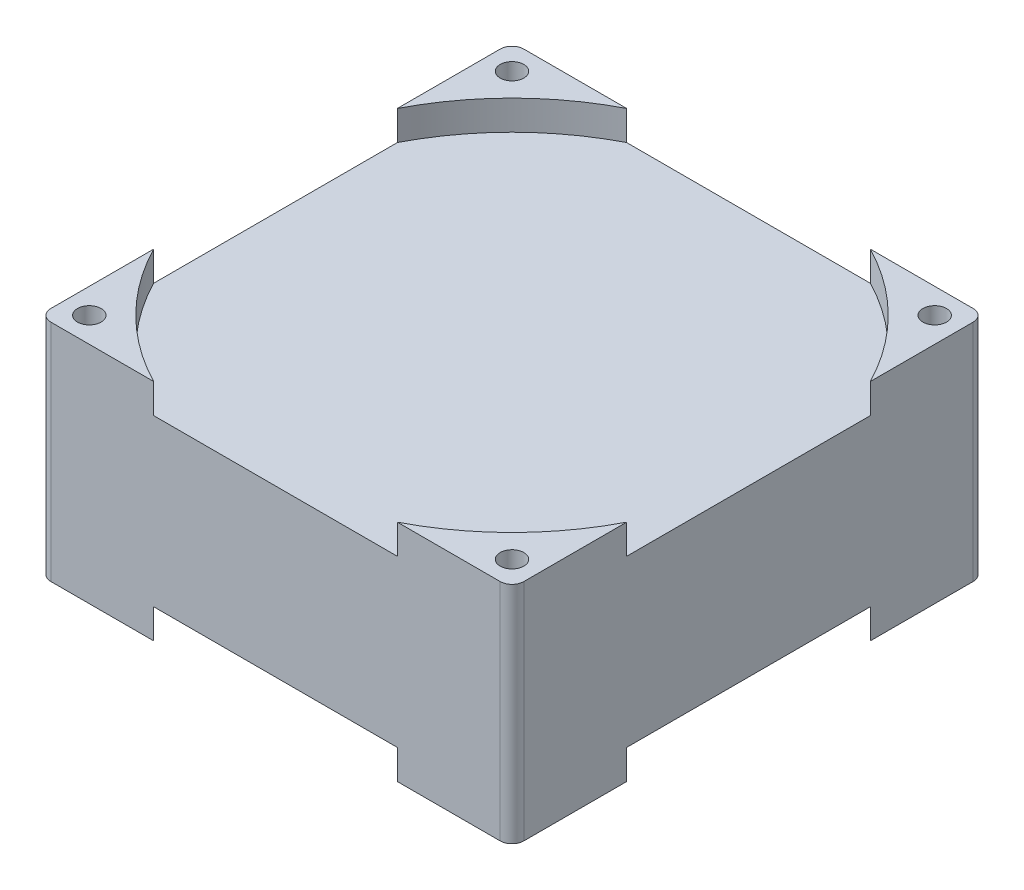
from build123d import *

# Parameters (mm, degrees)
SKETCH1_W          = 80
SKETCH1_H          = 80
BODY_DEPTH         = 38
SKETCH2_R          = 2
CUT_EXTRUDE1_DEPTH = 38
CUT_EXTRUDE2_DEPTH = 5
FILLET1_R          = 2
SKETCH4_W          = 1.709615385
SKETCH4_H          = 6.960576923
CUT_EXTRUDE3_DEPTH = 1


with BuildPart() as part:
    # Sketch1 → Body (new body)
    with BuildSketch(Plane(origin=(0, 0, 0), x_dir=(1, 0, 0), z_dir=(0, 1, 0))):
        Rectangle(SKETCH1_W, SKETCH1_H)
    extrude(amount=BODY_DEPTH)

    # Sketch2 → Cut-Extrude1 (cut)
    with BuildSketch(Plane(origin=(0, 38, 0), x_dir=(1, 0, 0), z_dir=(0, 1, 0))):
        with Locations((-35.75, 35.75)):
            Circle(SKETCH2_R)
        with Locations((35.75, 35.75)):
            Circle(SKETCH2_R)
        with Locations((35.75, -35.75)):
            Circle(SKETCH2_R)
        with Locations((-35.75, -35.75)):
            Circle(SKETCH2_R)
    extrude(amount=-CUT_EXTRUDE1_DEPTH, mode=Mode.SUBTRACT)

    # Sketch3 → Cut-Extrude2 (cut)
    with BuildSketch(Plane(origin=(0, 38, 0), x_dir=(1, 0, 0), z_dir=(0, 1, 0))):
        with BuildLine():
            Line((-40, 20.615528128), (-40, -20.615528128))
            ThreePointArc((-40, -20.615528128), (-31.819805153, -31.819805153), (-20.615528128, -40))
            Line((-20.615528128, -40), (20.615528128, -40))
            ThreePointArc((20.615528128, -40), (31.819805153, -31.819805153), (40, -20.615528128))
            Line((40, -20.615528128), (40, 20.615528128))
            ThreePointArc((40, 20.615528128), (31.819805153, 31.819805153), (20.615528128, 40))
            Line((20.615528128, 40), (-20.615528128, 40))
            ThreePointArc((-20.615528128, 40), (-31.819805153, 31.819805153), (-40, 20.615528128))
        make_face()
    cut_extrude2 = extrude(amount=-CUT_EXTRUDE2_DEPTH, mode=Mode.SUBTRACT)

    # Mirror1: Cut-Extrude2 across plane
    add(cut_extrude2.mirror(Plane.ZX.offset(19)), mode=Mode.SUBTRACT)

    # Fillet1
    fillet1_edges = [part.edges().sort_by_distance(p)[0] for p in [
        (-40, 19, 40),
        (40, 19, 40),
        (40, 19, -40),
        (-40, 19, -40),
    ]]
    fillet(fillet1_edges, radius=FILLET1_R)

    # Sketch4 → Cut-Extrude3 (cut)
    # profile 1 of 12: a face of its own
    with BuildSketch(Plane.ZY.offset(40)):
        Polygon((-34.596634615, 26.038548693), (-29.467788462, 26.038548693), (-29.467788462, 24.328933309), (-31.177403846, 24.328933309), (-31.177403846, 16.513548693), (-32.887019231, 16.513548693), (-32.887019231, 24.328933309), (-34.596634615, 24.328933309), align=None)
    # profile 2 of 12: a face of its own
    with BuildSketch(Plane.ZY.offset(40)):
        with BuildLine():
            Line((-28.36875, 26.282779462), (-26.659134615, 26.282779462))
            Line((-26.659134615, 26.282779462), (-26.659134615, 22.720444727))
            add(Edge.make_bspline(
                [(-26.659134615, 22.720444727), (-26.573017665, 22.790480118), (-26.405160806, 22.926991231), (-26.141787891, 23.104832819), (-25.878959731, 23.256592871), (-25.613887331, 23.379584016), (-25.347720672, 23.475964976), (-25.080000128, 23.544316743), (-24.810467967, 23.589161535), (-24.629777635, 23.593878662), (-24.539287861, 23.596241001)],
                knots=[0, 0, 0, 0, 1.13710654, 2.216417683, 3.252896077, 4.244436563, 5.207303112, 6.149540546, 7.073289332, 8, 8, 8, 8], degree=3))
            add(Edge.make_bspline(
                [(-24.539287861, 23.596241001), (-24.45269522, 23.593943337), (-24.282706595, 23.589432829), (-24.033322976, 23.55685279), (-23.794463271, 23.500790943), (-23.565539061, 23.423724215), (-23.3481253, 23.320080819), (-23.139394764, 23.198675667), (-22.941828495, 23.053220939), (-22.821620674, 22.94109734), (-22.760982572, 22.884537275)],
                knots=[0, 0, 0, 0, 1.056403236, 2.073808271, 3.062028718, 4.046096703, 5.014652014, 5.995532726, 6.988858718, 8, 8, 8, 8], degree=3))
            add(Edge.make_bspline(
                [(-22.760982572, 22.884537275), (-22.711182683, 22.831687074), (-22.610860359, 22.725219869), (-22.485911582, 22.541672866), (-22.37801956, 22.341744633), (-22.290102944, 22.12355646), (-22.224718005, 21.887006782), (-22.174096804, 21.63404433), (-22.146102203, 21.361907041), (-22.142647282, 21.174346641), (-22.140865385, 21.077611193)],
                knots=[0, 0, 0, 0, 0.887296576, 1.787466942, 2.706642908, 3.663267187, 4.658426068, 5.705361056, 6.816525637, 8, 8, 8, 8], degree=3))
            Line((-22.140865385, 21.077611193), (-22.140865385, 16.513548693))
            Line((-22.140865385, 16.513548693), (-23.850480769, 16.513548693))
            Line((-23.850480769, 16.513548693), (-23.850480769, 19.539720568))
            add(Edge.make_bspline(
                [(-23.850480769, 19.539720568), (-23.850812951, 19.635762128), (-23.851448782, 19.819595581), (-23.857158552, 20.083585245), (-23.866482786, 20.323409763), (-23.879234101, 20.53914161), (-23.897037724, 20.729879207), (-23.914548838, 20.896989689), (-23.939121034, 21.039672033), (-23.975914783, 21.194709961), (-24.035793355, 21.360535536), (-24.122806668, 21.537298471), (-24.239032545, 21.683182222), (-24.373535256, 21.803499741), (-24.529051829, 21.895330623), (-24.700014923, 21.963155319), (-24.889347248, 22.00129825), (-25.020583896, 22.006195284), (-25.088807091, 22.008741001)],
                knots=[0, 0, 0, 0, 1.461461505, 2.797388094, 4.017818807, 5.113567707, 6.085313608, 6.932873269, 7.669572396, 8.286941306, 9.355291607, 10.346554054, 11.270113241, 12.175128673, 13.078071705, 14.003657132, 14.962203834, 16, 16, 16, 16], degree=3))
            add(Edge.make_bspline(
                [(-25.088807091, 22.008741001), (-25.177681703, 22.0052666), (-25.351752649, 21.998461593), (-25.601378087, 21.928412188), (-25.831624713, 21.817690212), (-26.039805335, 21.664234535), (-26.221212655, 21.472025189), (-26.373203994, 21.246736639), (-26.497524587, 20.990622261), (-26.551258186, 20.803859227), (-26.578996394, 20.707448934)],
                knots=[0, 0, 0, 0, 0.993549393, 1.945978497, 2.879753144, 3.843180486, 4.826017097, 5.826060929, 6.877775219, 8, 8, 8, 8], degree=3))
            add(Edge.make_bspline(
                [(-26.578996394, 20.707448934), (-26.585903267, 20.677649914), (-26.601653198, 20.6096984), (-26.613714793, 20.493761444), (-26.631614009, 20.353613531), (-26.63782296, 20.188414819), (-26.649453796, 19.998420111), (-26.653636702, 19.783322006), (-26.657847826, 19.542918283), (-26.658691897, 19.37435929), (-26.659134615, 19.285949535)],
                knots=[0, 0, 0, 0, 0.514379255, 1.17295301, 1.959069106, 2.891908278, 3.953016936, 5.163065833, 6.51201855, 8, 8, 8, 8], degree=3))
            Line((-26.659134615, 19.285949535), (-26.659134615, 16.513548693))
            Line((-26.659134615, 16.513548693), (-28.36875, 16.513548693))
            Line((-28.36875, 16.513548693), (-28.36875, 26.282779462))
        make_face()
    # profile 3 of 12: a face of its own
    with BuildSketch(Plane.ZY.offset(40)):
        with BuildLine():
            add(Edge.make_bspline(
                [(-19.702373798, 26.404894847), (-19.628689387, 26.401279611), (-19.484002947, 26.394180747), (-19.276719932, 26.32498261), (-19.086476134, 26.216378203), (-18.91829534, 26.067370368), (-18.778418282, 25.889427759), (-18.671547015, 25.690209177), (-18.612013484, 25.469481405), (-18.603745158, 25.317004968), (-18.599519231, 25.239074535)],
                knots=[0, 0, 0, 0, 0.989868614, 1.943702388, 2.910836514, 3.924849579, 4.949916355, 5.946401046, 6.950409252, 8, 8, 8, 8], degree=3))
            add(Edge.make_bspline(
                [(-18.599519231, 25.239074535), (-18.603593961, 25.161718405), (-18.611533768, 25.010986304), (-18.672917216, 24.793255014), (-18.775499042, 24.594133193), (-18.916509016, 24.418833361), (-19.082866511, 24.272225385), (-19.268953336, 24.161649331), (-19.474249978, 24.096300671), (-19.616691322, 24.088608381), (-19.689017428, 24.084702539)],
                knots=[0, 0, 0, 0, 1.05296456, 2.051751585, 3.055639087, 4.085634717, 5.099016424, 6.062201612, 7.016062274, 8, 8, 8, 8], degree=3))
            add(Edge.make_bspline(
                [(-19.689017428, 24.084702539), (-19.763345043, 24.088304852), (-19.909290249, 24.095378134), (-20.118273411, 24.164738178), (-20.311054576, 24.272487255), (-20.478505802, 24.424539551), (-20.619984765, 24.603746577), (-20.722187853, 24.80760314), (-20.786118412, 25.029840244), (-20.793706914, 25.18457496), (-20.797596154, 25.263879222)],
                knots=[0, 0, 0, 0, 0.989065327, 1.942068821, 2.907541208, 3.917690034, 4.939857478, 5.938239964, 6.943311734, 8, 8, 8, 8], degree=3))
            add(Edge.make_bspline(
                [(-20.797596154, 25.263879222), (-20.793363597, 25.339921798), (-20.785049351, 25.489296461), (-20.725159207, 25.705116808), (-20.620738495, 25.900986214), (-20.481868985, 26.075671417), (-20.315165385, 26.221899696), (-20.125035793, 26.327205716), (-19.9191478, 26.393545772), (-19.775377897, 26.401072761), (-19.702373798, 26.404894847)],
                knots=[0, 0, 0, 0, 1.038616768, 2.040212704, 3.031499824, 4.052181184, 5.074969369, 6.039807101, 7.004644834, 8, 8, 8, 8], degree=3))
        make_face()
    # profile 4 of 12: a face of its own
    with BuildSketch(Plane.ZY.offset(40)):
        with Locations((-19.698557693, 19.993837154)):
            Rectangle(SKETCH4_W, SKETCH4_H)
    # profile 5 of 12: a face of its own
    with BuildSketch(Plane.ZY.offset(40)):
        with BuildLine():
            Line((-12.982211538, 22.399891842), (-14.027824519, 21.276048693))
            add(Edge.make_bspline(
                [(-14.027824519, 21.276048693), (-14.080036985, 21.333824617), (-14.179899652, 21.444328073), (-14.332779745, 21.594968981), (-14.483383155, 21.720408358), (-14.6289034, 21.825782662), (-14.772312521, 21.906592157), (-14.912418468, 21.964732779), (-15.049288463, 22.00164131), (-15.140011682, 22.00641898), (-15.184104567, 22.008741001)],
                knots=[0, 0, 0, 0, 1.327646587, 2.539285, 3.655602211, 4.666613517, 5.598770349, 6.454635452, 7.248928967, 8, 8, 8, 8], degree=3))
            add(Edge.make_bspline(
                [(-15.184104567, 22.008741001), (-15.228722138, 22.00738121), (-15.314150907, 22.004777634), (-15.434710042, 21.98244548), (-15.540629308, 21.943784406), (-15.630255766, 21.891085759), (-15.702263249, 21.826166438), (-15.752679046, 21.751900267), (-15.786533717, 21.670597097), (-15.789397603, 21.612844315), (-15.790865385, 21.583245208)],
                knots=[0, 0, 0, 0, 1.295068245, 2.479652818, 3.543291146, 4.55379989, 5.481948265, 6.332409746, 7.145336708, 8, 8, 8, 8], degree=3))
            add(Edge.make_bspline(
                [(-15.790865385, 21.583245208), (-15.785892406, 21.538389767), (-15.775574053, 21.445319938), (-15.70470128, 21.337372822), (-15.610931483, 21.257742445), (-15.50284202, 21.183641806), (-15.356460905, 21.100789358), (-15.245412476, 21.044057866), (-15.184104567, 21.012737395)],
                knots=[0, 0, 0, 0, 0.916701701, 1.902049539, 2.5493345, 3.440293453, 4.586830489, 6, 6, 6, 6], degree=3))
            Line((-15.184104567, 21.012737395), (-14.565895433, 20.699816722))
            add(Edge.make_bspline(
                [(-14.565895433, 20.699816722), (-14.48724741, 20.659881811), (-14.334655474, 20.582400582), (-14.120125505, 20.457374215), (-13.921982206, 20.336189681), (-13.744200274, 20.211991903), (-13.585691567, 20.086938611), (-13.447581967, 19.959793192), (-13.326521619, 19.834586398), (-13.191522337, 19.666718317), (-13.056482539, 19.443131691), (-12.943901288, 19.152367704), (-12.872109593, 18.841023405), (-12.864166669, 18.625530143), (-12.860096154, 18.515096169)],
                knots=[0, 0, 0, 0, 1.076693506, 2.088987655, 3.030641824, 3.911722491, 4.735175175, 5.493635918, 6.202154166, 6.859459289, 8.120623445, 9.372284821, 10.653373066, 12, 12, 12, 12], degree=3))
            add(Edge.make_bspline(
                [(-12.860096154, 18.515096169), (-12.862548666, 18.440592714), (-12.867348882, 18.294769682), (-12.897694836, 18.08013208), (-12.952204029, 17.8760435), (-13.023938045, 17.679322607), (-13.120561614, 17.493526717), (-13.237867362, 17.317755153), (-13.374002986, 17.149700133), (-13.532567428, 16.995110488), (-13.706272123, 16.85103463), (-13.899374205, 16.729856488), (-14.10333554, 16.62331305), (-14.323544463, 16.540112111), (-14.55691117, 16.472658255), (-14.805436094, 16.425914423), (-15.06827594, 16.396497332), (-15.248260724, 16.393149979), (-15.340564904, 16.391433309)],
                knots=[0, 0, 0, 0, 0.976600749, 1.911466839, 2.833459288, 3.740827163, 4.650527853, 5.570709661, 6.506801416, 7.479409329, 8.468875524, 9.458587492, 10.461481786, 11.480119772, 12.538142914, 13.641687514, 14.790552763, 16, 16, 16, 16], degree=3))
            add(Edge.make_bspline(
                [(-15.340564904, 16.391433309), (-15.462860015, 16.395327728), (-15.70291455, 16.402972132), (-16.053496819, 16.456221952), (-16.384539554, 16.548398289), (-16.696315112, 16.677525546), (-16.990733073, 16.84206907), (-17.26358882, 17.046231563), (-17.519612555, 17.284693733), (-17.668569824, 17.467583111), (-17.744711538, 17.561069727)],
                knots=[0, 0, 0, 0, 1.056901255, 2.07460411, 3.05625841, 4.019970729, 4.984811261, 5.963335951, 6.958928997, 8, 8, 8, 8], degree=3))
            Line((-17.744711538, 17.561069727), (-16.708638822, 18.711625616))
            add(Edge.make_bspline(
                [(-16.708638822, 18.711625616), (-16.658157861, 18.658381183), (-16.557936642, 18.55267357), (-16.389004167, 18.413283791), (-16.210261643, 18.286240261), (-16.019719241, 18.179565148), (-15.829138336, 18.093429795), (-15.646291683, 18.02881623), (-15.474625228, 17.988210967), (-15.363012124, 17.981919495), (-15.310036058, 17.978933309)],
                knots=[0, 0, 0, 0, 1.087861918, 2.159761696, 3.243809206, 4.338405912, 5.394481878, 6.343674753, 7.213841449, 8, 8, 8, 8], degree=3))
            add(Edge.make_bspline(
                [(-15.310036058, 17.978933309), (-15.257088667, 17.980466701), (-15.155309169, 17.983414303), (-15.010654147, 18.014075153), (-14.882439736, 18.065620571), (-14.773709142, 18.137089602), (-14.683269943, 18.219125134), (-14.619545652, 18.312358998), (-14.577407776, 18.41122238), (-14.572286411, 18.480343893), (-14.569711538, 18.515096169)],
                knots=[0, 0, 0, 0, 1.255011871, 2.412479185, 3.488767498, 4.514443302, 5.48617286, 6.365347346, 7.178144445, 8, 8, 8, 8], degree=3))
            add(Edge.make_bspline(
                [(-14.569711538, 18.515096169), (-14.572009089, 18.547822753), (-14.576726402, 18.615016739), (-14.614073521, 18.71419987), (-14.672709234, 18.812407083), (-14.754033768, 18.909915271), (-14.85912925, 19.005933269), (-14.98761957, 19.099692005), (-15.136540452, 19.196193623), (-15.246541892, 19.253792166), (-15.304311899, 19.284041482)],
                knots=[0, 0, 0, 0, 0.704666567, 1.446816302, 2.258757648, 3.165368109, 4.175243826, 5.322435858, 6.59381024, 8, 8, 8, 8], degree=3))
            Line((-15.304311899, 19.284041482), (-15.871003606, 19.570249414))
            add(Edge.make_bspline(
                [(-15.871003606, 19.570249414), (-15.999551907, 19.639182156), (-16.246316448, 19.771507175), (-16.579849862, 19.998416461), (-16.862137747, 20.239965913), (-17.093410143, 20.494857842), (-17.277688446, 20.762376963), (-17.406234926, 21.045929315), (-17.487102403, 21.34282676), (-17.49599912, 21.545848454), (-17.500480769, 21.648119006)],
                knots=[0, 0, 0, 0, 1.255999728, 2.41104856, 3.467751088, 4.449286722, 5.368722015, 6.253902015, 7.120417131, 8, 8, 8, 8], degree=3))
            add(Edge.make_bspline(
                [(-17.500480769, 21.648119006), (-17.49892657, 21.714401165), (-17.495875426, 21.844523812), (-17.463394158, 22.035617938), (-17.414321932, 22.219307972), (-17.345075736, 22.395885631), (-17.256372567, 22.565526127), (-17.147695796, 22.727476609), (-17.017719576, 22.88144265), (-16.870604994, 23.026928291), (-16.707376748, 23.159428329), (-16.532698518, 23.276854346), (-16.347086969, 23.376879477), (-16.149018813, 23.456626627), (-15.941011603, 23.520100395), (-15.721692269, 23.563245335), (-15.491996529, 23.590685667), (-15.334921276, 23.594362985), (-15.254702524, 23.596241001)],
                knots=[0, 0, 0, 0, 0.959035663, 1.882742823, 2.798841253, 3.708806893, 4.623422363, 5.566085165, 6.527241613, 7.536786942, 8.55815439, 9.567237405, 10.580975912, 11.605536372, 12.654523293, 13.725718749, 14.838518481, 16, 16, 16, 16], degree=3))
            add(Edge.make_bspline(
                [(-15.254702524, 23.596241001), (-15.143799581, 23.592589619), (-14.923676802, 23.585342269), (-14.599038996, 23.52669667), (-14.285472549, 23.428126954), (-13.983856535, 23.292314369), (-13.698070677, 23.121636548), (-13.434399544, 22.914376029), (-13.191058702, 22.675636505), (-13.052518558, 22.492719464), (-12.982211538, 22.399891842)],
                knots=[0, 0, 0, 0, 0.996590028, 1.978055413, 2.954661574, 3.945146934, 4.945404762, 5.939399542, 6.954276554, 8, 8, 8, 8], degree=3))
        make_face()
    # profile 6 of 12: a face of its own
    with BuildSketch(Plane.ZY.offset(40)):
        with BuildLine():
            add(Edge.make_bspline(
                [(-7.002373798, 26.404894847), (-6.928689387, 26.401279611), (-6.784002947, 26.394180747), (-6.576719932, 26.32498261), (-6.386476134, 26.216378203), (-6.21829534, 26.067370368), (-6.078418282, 25.889427759), (-5.971547015, 25.690209177), (-5.912013484, 25.469481405), (-5.903745158, 25.317004968), (-5.899519231, 25.239074535)],
                knots=[0, 0, 0, 0, 0.989868614, 1.943702388, 2.910836514, 3.924849579, 4.949916355, 5.946401046, 6.950409252, 8, 8, 8, 8], degree=3))
            add(Edge.make_bspline(
                [(-5.899519231, 25.239074535), (-5.903593961, 25.161718405), (-5.911533768, 25.010986304), (-5.972917216, 24.793255014), (-6.075499042, 24.594133193), (-6.216509016, 24.418833361), (-6.382866511, 24.272225385), (-6.568953336, 24.161649331), (-6.774249978, 24.096300671), (-6.916691322, 24.088608381), (-6.989017428, 24.084702539)],
                knots=[0, 0, 0, 0, 1.05296456, 2.051751585, 3.055639087, 4.085634717, 5.099016424, 6.062201612, 7.016062274, 8, 8, 8, 8], degree=3))
            add(Edge.make_bspline(
                [(-6.989017428, 24.084702539), (-7.063345043, 24.088304852), (-7.209290249, 24.095378134), (-7.418273411, 24.164738178), (-7.611054576, 24.272487255), (-7.778505802, 24.424539551), (-7.919984765, 24.603746577), (-8.022187853, 24.80760314), (-8.086118412, 25.029840244), (-8.093706914, 25.18457496), (-8.097596154, 25.263879222)],
                knots=[0, 0, 0, 0, 0.989065327, 1.942068821, 2.907541208, 3.917690034, 4.939857478, 5.938239964, 6.943311734, 8, 8, 8, 8], degree=3))
            add(Edge.make_bspline(
                [(-8.097596154, 25.263879222), (-8.093363597, 25.339921798), (-8.085049351, 25.489296461), (-8.025159207, 25.705116808), (-7.920738495, 25.900986214), (-7.781868985, 26.075671417), (-7.615165385, 26.221899696), (-7.425035793, 26.327205716), (-7.2191478, 26.393545772), (-7.075377897, 26.401072761), (-7.002373798, 26.404894847)],
                knots=[0, 0, 0, 0, 1.038616768, 2.040212704, 3.031499824, 4.052181184, 5.074969369, 6.039807101, 7.004644834, 8, 8, 8, 8], degree=3))
        make_face()
    # profile 7 of 12: a face of its own
    with BuildSketch(Plane.ZY.offset(40)):
        with Locations((-6.998557693, 19.993837154)):
            Rectangle(SKETCH4_W, SKETCH4_H)
    # profile 8 of 12: a face of its own
    with BuildSketch(Plane.ZY.offset(40)):
        with BuildLine():
            Line((-0.282211538, 22.399891842), (-1.327824519, 21.276048693))
            add(Edge.make_bspline(
                [(-1.327824519, 21.276048693), (-1.380036985, 21.333824617), (-1.479899652, 21.444328073), (-1.632779745, 21.594968981), (-1.783383155, 21.720408358), (-1.9289034, 21.825782662), (-2.072312521, 21.906592157), (-2.212418468, 21.964732779), (-2.349288463, 22.00164131), (-2.440011682, 22.00641898), (-2.484104567, 22.008741001)],
                knots=[0, 0, 0, 0, 1.327646587, 2.539285, 3.655602211, 4.666613517, 5.598770349, 6.454635452, 7.248928967, 8, 8, 8, 8], degree=3))
            add(Edge.make_bspline(
                [(-2.484104567, 22.008741001), (-2.528722138, 22.00738121), (-2.614150907, 22.004777634), (-2.734710042, 21.98244548), (-2.840629308, 21.943784406), (-2.930255766, 21.891085759), (-3.002263249, 21.826166438), (-3.052679046, 21.751900267), (-3.086533717, 21.670597097), (-3.089397603, 21.612844315), (-3.090865385, 21.583245208)],
                knots=[0, 0, 0, 0, 1.295068245, 2.479652818, 3.543291146, 4.55379989, 5.481948265, 6.332409746, 7.145336708, 8, 8, 8, 8], degree=3))
            add(Edge.make_bspline(
                [(-3.090865385, 21.583245208), (-3.085892406, 21.538389767), (-3.075574053, 21.445319938), (-3.00470128, 21.337372822), (-2.910931483, 21.257742445), (-2.80284202, 21.183641806), (-2.656460905, 21.100789358), (-2.545412476, 21.044057866), (-2.484104567, 21.012737395)],
                knots=[0, 0, 0, 0, 0.916701701, 1.902049539, 2.5493345, 3.440293453, 4.586830489, 6, 6, 6, 6], degree=3))
            Line((-2.484104567, 21.012737395), (-1.865895433, 20.699816722))
            add(Edge.make_bspline(
                [(-1.865895433, 20.699816722), (-1.78724741, 20.659881811), (-1.634655474, 20.582400582), (-1.420125505, 20.457374215), (-1.221982206, 20.336189681), (-1.044200274, 20.211991903), (-0.885691567, 20.086938611), (-0.747581967, 19.959793192), (-0.626521619, 19.834586398), (-0.491522337, 19.666718317), (-0.356482539, 19.443131691), (-0.243901288, 19.152367704), (-0.172109593, 18.841023405), (-0.164166669, 18.625530143), (-0.160096154, 18.515096169)],
                knots=[0, 0, 0, 0, 1.076693506, 2.088987655, 3.030641824, 3.911722491, 4.735175175, 5.493635918, 6.202154166, 6.859459289, 8.120623445, 9.372284821, 10.653373066, 12, 12, 12, 12], degree=3))
            add(Edge.make_bspline(
                [(-0.160096154, 18.515096169), (-0.162548666, 18.440592714), (-0.167348882, 18.294769682), (-0.197694836, 18.08013208), (-0.252204029, 17.8760435), (-0.323938045, 17.679322607), (-0.420561614, 17.493526717), (-0.537867362, 17.317755153), (-0.674002986, 17.149700133), (-0.832567428, 16.995110488), (-1.006272123, 16.85103463), (-1.199374205, 16.729856488), (-1.40333554, 16.62331305), (-1.623544463, 16.540112111), (-1.85691117, 16.472658255), (-2.105436094, 16.425914423), (-2.36827594, 16.396497332), (-2.548260724, 16.393149979), (-2.640564904, 16.391433309)],
                knots=[0, 0, 0, 0, 0.976600749, 1.911466839, 2.833459288, 3.740827163, 4.650527853, 5.570709661, 6.506801416, 7.479409329, 8.468875524, 9.458587492, 10.461481786, 11.480119772, 12.538142914, 13.641687514, 14.790552763, 16, 16, 16, 16], degree=3))
            add(Edge.make_bspline(
                [(-2.640564904, 16.391433309), (-2.762860015, 16.395327728), (-3.00291455, 16.402972132), (-3.353496819, 16.456221952), (-3.684539554, 16.548398289), (-3.996315112, 16.677525546), (-4.290733073, 16.84206907), (-4.56358882, 17.046231563), (-4.819612555, 17.284693733), (-4.968569824, 17.467583111), (-5.044711538, 17.561069727)],
                knots=[0, 0, 0, 0, 1.056901255, 2.07460411, 3.05625841, 4.019970729, 4.984811261, 5.963335951, 6.958928997, 8, 8, 8, 8], degree=3))
            Line((-5.044711538, 17.561069727), (-4.008638822, 18.711625616))
            add(Edge.make_bspline(
                [(-4.008638822, 18.711625616), (-3.958157861, 18.658381183), (-3.857936642, 18.55267357), (-3.689004167, 18.413283791), (-3.510261643, 18.286240261), (-3.319719241, 18.179565148), (-3.129138336, 18.093429795), (-2.946291683, 18.02881623), (-2.774625228, 17.988210967), (-2.663012124, 17.981919495), (-2.610036058, 17.978933309)],
                knots=[0, 0, 0, 0, 1.087861918, 2.159761696, 3.243809206, 4.338405912, 5.394481878, 6.343674753, 7.213841449, 8, 8, 8, 8], degree=3))
            add(Edge.make_bspline(
                [(-2.610036058, 17.978933309), (-2.557088667, 17.980466701), (-2.455309169, 17.983414303), (-2.310654147, 18.014075153), (-2.182439736, 18.065620571), (-2.073709142, 18.137089602), (-1.983269943, 18.219125134), (-1.919545652, 18.312358998), (-1.877407776, 18.41122238), (-1.872286411, 18.480343893), (-1.869711538, 18.515096169)],
                knots=[0, 0, 0, 0, 1.255011871, 2.412479185, 3.488767498, 4.514443302, 5.48617286, 6.365347346, 7.178144445, 8, 8, 8, 8], degree=3))
            add(Edge.make_bspline(
                [(-1.869711538, 18.515096169), (-1.872009089, 18.547822753), (-1.876726402, 18.615016739), (-1.914073521, 18.71419987), (-1.972709234, 18.812407083), (-2.054033768, 18.909915271), (-2.15912925, 19.005933269), (-2.28761957, 19.099692005), (-2.436540452, 19.196193623), (-2.546541892, 19.253792166), (-2.604311899, 19.284041482)],
                knots=[0, 0, 0, 0, 0.704666567, 1.446816302, 2.258757648, 3.165368109, 4.175243826, 5.322435858, 6.59381024, 8, 8, 8, 8], degree=3))
            Line((-2.604311899, 19.284041482), (-3.171003606, 19.570249414))
            add(Edge.make_bspline(
                [(-3.171003606, 19.570249414), (-3.299551907, 19.639182156), (-3.546316448, 19.771507175), (-3.879849862, 19.998416461), (-4.162137747, 20.239965913), (-4.393410143, 20.494857842), (-4.577688446, 20.762376963), (-4.706234926, 21.045929315), (-4.787102403, 21.34282676), (-4.79599912, 21.545848454), (-4.800480769, 21.648119006)],
                knots=[0, 0, 0, 0, 1.255999728, 2.41104856, 3.467751088, 4.449286722, 5.368722015, 6.253902015, 7.120417131, 8, 8, 8, 8], degree=3))
            add(Edge.make_bspline(
                [(-4.800480769, 21.648119006), (-4.79892657, 21.714401165), (-4.795875426, 21.844523812), (-4.763394158, 22.035617938), (-4.714321932, 22.219307972), (-4.645075736, 22.395885631), (-4.556372567, 22.565526127), (-4.447695796, 22.727476609), (-4.317719576, 22.88144265), (-4.170604994, 23.026928291), (-4.007376748, 23.159428329), (-3.832698518, 23.276854346), (-3.647086969, 23.376879477), (-3.449018813, 23.456626627), (-3.241011603, 23.520100395), (-3.021692269, 23.563245335), (-2.791996529, 23.590685667), (-2.634921276, 23.594362985), (-2.554702524, 23.596241001)],
                knots=[0, 0, 0, 0, 0.959035663, 1.882742823, 2.798841253, 3.708806893, 4.623422363, 5.566085165, 6.527241613, 7.536786942, 8.55815439, 9.567237405, 10.580975912, 11.605536372, 12.654523293, 13.725718749, 14.838518481, 16, 16, 16, 16], degree=3))
            add(Edge.make_bspline(
                [(-2.554702524, 23.596241001), (-2.443799581, 23.592589619), (-2.223676802, 23.585342269), (-1.899038996, 23.52669667), (-1.585472549, 23.428126954), (-1.283856535, 23.292314369), (-0.998070677, 23.121636548), (-0.734399544, 22.914376029), (-0.491058702, 22.675636505), (-0.352518558, 22.492719464), (-0.282211538, 22.399891842)],
                knots=[0, 0, 0, 0, 0.996590028, 1.978055413, 2.954661574, 3.945146934, 4.945404762, 5.939399542, 6.954276554, 8, 8, 8, 8], degree=3))
        make_face()
    # profile 9 of 12: a face of its own
    with BuildSketch(Plane.ZY.offset(40)):
        with BuildLine():
            Line((10.219711538, 23.474125616), (11.929326923, 23.474125616))
            Line((11.929326923, 23.474125616), (11.929326923, 16.513548693))
            Line((11.929326923, 16.513548693), (10.219711538, 16.513548693))
            Line((10.219711538, 16.513548693), (10.219711538, 17.272953741))
            add(Edge.make_bspline(
                [(10.219711538, 17.272953741), (10.135000726, 17.199034065), (9.970593768, 17.05557057), (9.711541601, 16.869423038), (9.451732453, 16.715875382), (9.189917935, 16.593583048), (8.922074068, 16.503282747), (8.646272482, 16.437903219), (8.358541341, 16.399347312), (8.162945676, 16.394098788), (8.063611779, 16.391433309)],
                knots=[0, 0, 0, 0, 1.129196829, 2.191548051, 3.199897424, 4.157751732, 5.089409408, 6.034969131, 7.002052659, 8, 8, 8, 8], degree=3))
            add(Edge.make_bspline(
                [(8.063611779, 16.391433309), (7.952105064, 16.393941861), (7.731761475, 16.398898902), (7.40843172, 16.451079763), (7.096224698, 16.530954201), (6.795393833, 16.643986513), (6.50648646, 16.790454231), (6.227291561, 16.966535807), (5.962595387, 17.178412757), (5.710194434, 17.416917705), (5.479097636, 17.679274845), (5.277070633, 17.961842696), (5.106776884, 18.260613657), (4.967264328, 18.574597164), (4.857519687, 18.90356277), (4.779287461, 19.248553856), (4.733130358, 19.609693635), (4.727417409, 19.855687909), (4.724519231, 19.980480785)],
                knots=[0, 0, 0, 0, 0.980476535, 1.937477201, 2.874147792, 3.812856188, 4.758993464, 5.720109578, 6.712210464, 7.737600662, 8.772720504, 9.783789959, 10.789002326, 11.793715968, 12.802552247, 13.835794126, 14.902098527, 16, 16, 16, 16], degree=3))
            add(Edge.make_bspline(
                [(4.724519231, 19.980480785), (4.72756088, 20.109703972), (4.733527414, 20.363189652), (4.777172251, 20.735167836), (4.853960798, 21.088712947), (4.958667501, 21.424314697), (5.093354493, 21.742031066), (5.257394251, 22.042382574), (5.45301838, 22.324584151), (5.67844051, 22.583832526), (5.921841044, 22.821446185), (6.182236586, 23.028307718), (6.455555119, 23.204046216), (6.742087093, 23.347517028), (7.041791587, 23.458384012), (7.353485375, 23.539436829), (7.678552157, 23.588071367), (7.899990283, 23.593495174), (8.012094351, 23.596241001)],
                knots=[0, 0, 0, 0, 1.136281865, 2.228943489, 3.287578264, 4.313574083, 5.316051562, 6.317280042, 7.318008486, 8.329309503, 9.333984563, 10.305318864, 11.248632312, 12.186624717, 13.117503092, 14.05354244, 15.014596925, 16, 16, 16, 16], degree=3))
            add(Edge.make_bspline(
                [(8.012094351, 23.596241001), (8.115939042, 23.594083606), (8.321410254, 23.589814898), (8.623423331, 23.543464905), (8.916332457, 23.473363831), (9.198539798, 23.373482419), (9.472360111, 23.247361817), (9.733083515, 23.089323301), (9.986413569, 22.90600916), (10.140984734, 22.762836933), (10.219711538, 22.689915881)],
                knots=[0, 0, 0, 0, 1.017011718, 2.012299608, 2.98747302, 3.965332399, 4.941441765, 5.936729654, 6.94912688, 8, 8, 8, 8], degree=3))
            Line((10.219711538, 22.689915881), (10.219711538, 23.474125616))
        make_face()
        with BuildLine():
            add(Edge.make_bspline(
                [(8.370808293, 22.008741001), (8.30268516, 22.006650748), (8.169168266, 22.002553989), (7.972813403, 21.977911697), (7.785157057, 21.93449088), (7.607537579, 21.870345947), (7.437307787, 21.792208073), (7.277052647, 21.694341672), (7.125449524, 21.578665666), (6.983390012, 21.447980568), (6.853881836, 21.304333752), (6.74223823, 21.147583953), (6.647359201, 20.981954687), (6.567116202, 20.806947964), (6.50968042, 20.620492913), (6.464191304, 20.425016848), (6.440585398, 20.218922829), (6.436306391, 20.078476133), (6.434134615, 20.007193525)],
                knots=[0, 0, 0, 0, 1.04836806, 2.054732945, 3.03993516, 4.00574415, 4.955904794, 5.917688631, 6.888591924, 7.88601754, 8.884115178, 9.859153345, 10.841239365, 11.818093293, 12.814750328, 13.83810466, 14.90274714, 16, 16, 16, 16], degree=3))
            add(Edge.make_bspline(
                [(6.434134615, 20.007193525), (6.436273217, 19.935264342), (6.440487306, 19.793528722), (6.464572989, 19.585696226), (6.508425218, 19.387364715), (6.572403967, 19.200137563), (6.65053686, 19.021488458), (6.745642163, 18.852241882), (6.862462369, 18.695390326), (6.992084072, 18.547222156), (7.137057913, 18.41491373), (7.289518867, 18.297435995), (7.451549433, 18.19914245), (7.621391692, 18.119700985), (7.798473947, 18.054962868), (7.985016274, 18.012087762), (8.179191256, 17.984678518), (8.311565468, 17.980861603), (8.378440505, 17.978933309)],
                knots=[0, 0, 0, 0, 1.099136573, 2.165835871, 3.191374663, 4.196217796, 5.183857741, 6.167377911, 7.154730987, 8.166690795, 9.170734848, 10.148332609, 11.103258353, 12.059567475, 13.009337315, 13.978056681, 14.978520572, 16, 16, 16, 16], degree=3))
            add(Edge.make_bspline(
                [(8.378440505, 17.978933309), (8.447832511, 17.98103528), (8.583878567, 17.985156286), (8.783436861, 18.009573691), (8.973614104, 18.053153714), (9.153619058, 18.117665891), (9.326201126, 18.19524289), (9.489802911, 18.291196907), (9.642649086, 18.406607469), (9.785513747, 18.538473963), (9.916421669, 18.683293741), (10.029609218, 18.842099065), (10.128199714, 19.009810904), (10.205736603, 19.190394578), (10.267311767, 19.380690715), (10.311490526, 19.581880333), (10.33552121, 19.794180339), (10.339698443, 19.939083366), (10.341826923, 20.012917684)],
                knots=[0, 0, 0, 0, 1.050008698, 2.058587853, 3.036635738, 3.995319155, 4.947022481, 5.895997462, 6.858296291, 7.838991643, 8.833936038, 9.806048392, 10.784806122, 11.771666913, 12.772873988, 13.80724452, 14.882696879, 16, 16, 16, 16], degree=3))
            add(Edge.make_bspline(
                [(10.341826923, 20.012917684), (10.339724892, 20.085482086), (10.335619014, 20.227221443), (10.311386888, 20.435088725), (10.266894485, 20.632327898), (10.20658664, 20.819301512), (10.127670345, 20.995582055), (10.029005253, 21.159214996), (9.917059306, 21.315869602), (9.784702045, 21.456776997), (9.642611314, 21.587688676), (9.487517288, 21.699609138), (9.324306271, 21.796065299), (9.151975492, 21.875259526), (8.968929244, 21.933311897), (8.778427001, 21.978259724), (8.57749653, 22.002539199), (8.440828678, 22.006639998), (8.370808293, 22.008741001)],
                knots=[0, 0, 0, 0, 1.106611376, 2.161533483, 3.185006901, 4.184773755, 5.152708835, 6.122342771, 7.094156588, 8.082475533, 9.064254463, 10.03606828, 10.992420271, 11.951521816, 12.920622147, 13.915721683, 14.932141191, 16, 16, 16, 16], degree=3))
        make_face(mode=Mode.SUBTRACT)
    # profile 10 of 12: a face of its own
    with BuildSketch(Plane.ZY.offset(40)):
        with BuildLine():
            Line((16.447596154, 23.474125616), (17.058173077, 23.474125616))
            add(Edge.make_bspline(
                [(17.058173077, 23.474125616), (17.05858111, 23.584794882), (17.059352646, 23.794055416), (17.063909208, 24.090426547), (17.066981922, 24.351219368), (17.072470466, 24.576393765), (17.080195006, 24.765290164), (17.088113477, 24.917898239), (17.094044943, 25.035180857), (17.102407523, 25.101085406), (17.105874399, 25.128407467)],
                knots=[0, 0, 0, 0, 1.604323161, 3.033556972, 4.296844687, 5.385167547, 6.298701784, 7.037230881, 7.60086462, 8, 8, 8, 8], degree=3))
            add(Edge.make_bspline(
                [(17.105874399, 25.128407467), (17.122130999, 25.222146014), (17.153820613, 25.404874165), (17.258723468, 25.659560203), (17.411155772, 25.8814209), (17.572743374, 26.038021908), (17.722493655, 26.144929453), (17.848121696, 26.214754595), (17.9847193, 26.274616085), (18.132727808, 26.321554669), (18.290739563, 26.35989749), (18.460459786, 26.386551518), (18.640957332, 26.401240225), (18.765218305, 26.403657223), (18.828846154, 26.404894847)],
                knots=[0, 0, 0, 0, 1.43722947, 2.801646624, 4.13175475, 5.486897933, 6.18427957, 6.91287343, 7.658885333, 8.438447905, 9.260561323, 10.118602268, 11.036630026, 12, 12, 12, 12], degree=3))
            add(Edge.make_bspline(
                [(18.828846154, 26.404894847), (18.926334479, 26.401852577), (19.129383057, 26.39551614), (19.441350678, 26.344289944), (19.772326558, 26.265870932), (19.995153541, 26.192897354), (20.111057692, 26.154939919)],
                knots=[0, 0, 0, 0, 0.891275659, 1.856347963, 2.884972697, 4, 4, 4, 4], degree=3))
            Line((20.111057692, 26.154939919), (20.111057692, 24.825027059))
            add(Edge.make_bspline(
                [(20.111057692, 24.825027059), (20.048890782, 24.842215161), (19.930324589, 24.874996715), (19.759726623, 24.911387151), (19.60601268, 24.933858156), (19.509446115, 24.93770766), (19.464227764, 24.939510232)],
                knots=[0, 0, 0, 0, 1.174725213, 2.24046353, 3.176077791, 4, 4, 4, 4], degree=3))
            add(Edge.make_bspline(
                [(19.464227764, 24.939510232), (19.414461787, 24.938461507), (19.321208018, 24.936496357), (19.191944721, 24.911495821), (19.08126778, 24.872131366), (19.023861056, 24.827174308), (18.996754808, 24.80594653)],
                knots=[0, 0, 0, 0, 1.199997209, 2.248609783, 3.173030359, 4, 4, 4, 4], degree=3))
            add(Edge.make_bspline(
                [(18.996754808, 24.80594653), (18.980352148, 24.78499352), (18.944113314, 24.738701475), (18.911174539, 24.644239552), (18.894451889, 24.524848017), (18.891513664, 24.436492099), (18.889903846, 24.388082948)],
                knots=[0, 0, 0, 0, 0.721105823, 1.593158367, 2.681320256, 4, 4, 4, 4], degree=3))
            Line((18.889903846, 24.388082948), (18.884179687, 23.474125616))
            Line((18.884179687, 23.474125616), (19.988942308, 23.474125616))
            Line((19.988942308, 23.474125616), (19.988942308, 22.008741001))
            Line((19.988942308, 22.008741001), (18.767788462, 22.008741001))
            Line((18.767788462, 22.008741001), (18.767788462, 16.513548693))
            Line((18.767788462, 16.513548693), (17.058173077, 16.513548693))
            Line((17.058173077, 16.513548693), (17.058173077, 22.008741001))
            Line((17.058173077, 22.008741001), (16.447596154, 22.008741001))
            Line((16.447596154, 22.008741001), (16.447596154, 23.474125616))
        make_face()
    # profile 11 of 12: a face of its own
    with BuildSketch(Plane.ZY.offset(40)):
        with BuildLine():
            Line((26.216826923, 23.474125616), (27.926442308, 23.474125616))
            Line((27.926442308, 23.474125616), (27.926442308, 16.513548693))
            Line((27.926442308, 16.513548693), (26.216826923, 16.513548693))
            Line((26.216826923, 16.513548693), (26.216826923, 17.272953741))
            add(Edge.make_bspline(
                [(26.216826923, 17.272953741), (26.132116111, 17.199034065), (25.967709152, 17.05557057), (25.708656985, 16.869423038), (25.448847838, 16.715875382), (25.18703332, 16.593583048), (24.919189452, 16.503282747), (24.643387866, 16.437903219), (24.355656726, 16.399347312), (24.16006106, 16.394098788), (24.060727163, 16.391433309)],
                knots=[0, 0, 0, 0, 1.129196829, 2.191548051, 3.199897424, 4.157751732, 5.089409408, 6.034969131, 7.002052659, 8, 8, 8, 8], degree=3))
            add(Edge.make_bspline(
                [(24.060727163, 16.391433309), (23.949220448, 16.393941861), (23.728876859, 16.398898902), (23.405547105, 16.451079763), (23.093340082, 16.530954201), (22.792509218, 16.643986513), (22.503601844, 16.790454231), (22.224406945, 16.966535807), (21.959710772, 17.178412757), (21.707309819, 17.416917705), (21.476213021, 17.679274845), (21.274186018, 17.961842696), (21.103892269, 18.260613657), (20.964379713, 18.574597164), (20.854635071, 18.90356277), (20.776402846, 19.248553856), (20.730245743, 19.609693635), (20.724532794, 19.855687909), (20.721634615, 19.980480785)],
                knots=[0, 0, 0, 0, 0.980476535, 1.937477201, 2.874147792, 3.812856188, 4.758993464, 5.720109578, 6.712210464, 7.737600662, 8.772720504, 9.783789959, 10.789002326, 11.793715968, 12.802552247, 13.835794126, 14.902098527, 16, 16, 16, 16], degree=3))
            add(Edge.make_bspline(
                [(20.721634615, 19.980480785), (20.724676265, 20.109703972), (20.730642798, 20.363189652), (20.774287636, 20.735167836), (20.851076183, 21.088712947), (20.955782886, 21.424314697), (21.090469878, 21.742031066), (21.254509635, 22.042382574), (21.450133765, 22.324584151), (21.675555895, 22.583832526), (21.918956429, 22.821446185), (22.179351971, 23.028307718), (22.452670504, 23.204046216), (22.739202477, 23.347517028), (23.038906972, 23.458384012), (23.35060076, 23.539436829), (23.675667542, 23.588071367), (23.897105668, 23.593495174), (24.009209736, 23.596241001)],
                knots=[0, 0, 0, 0, 1.136281865, 2.228943489, 3.287578264, 4.313574083, 5.316051562, 6.317280042, 7.318008486, 8.329309503, 9.333984563, 10.305318864, 11.248632312, 12.186624717, 13.117503092, 14.05354244, 15.014596925, 16, 16, 16, 16], degree=3))
            add(Edge.make_bspline(
                [(24.009209736, 23.596241001), (24.113054426, 23.594083606), (24.318525639, 23.589814898), (24.620538716, 23.543464905), (24.913447842, 23.473363831), (25.195655182, 23.373482419), (25.469475496, 23.247361817), (25.7301989, 23.089323301), (25.983528954, 22.90600916), (26.138100118, 22.762836933), (26.216826923, 22.689915881)],
                knots=[0, 0, 0, 0, 1.017011718, 2.012299608, 2.98747302, 3.965332399, 4.941441765, 5.936729654, 6.94912688, 8, 8, 8, 8], degree=3))
            Line((26.216826923, 22.689915881), (26.216826923, 23.474125616))
        make_face()
        with BuildLine():
            add(Edge.make_bspline(
                [(24.367923678, 22.008741001), (24.299800544, 22.006650748), (24.166283651, 22.002553989), (23.969928787, 21.977911697), (23.782272441, 21.93449088), (23.604652964, 21.870345947), (23.434423172, 21.792208073), (23.274168031, 21.694341672), (23.122564908, 21.578665666), (22.980505397, 21.447980568), (22.850997221, 21.304333752), (22.739353614, 21.147583953), (22.644474586, 20.981954687), (22.564231586, 20.806947964), (22.506795804, 20.620492913), (22.461306689, 20.425016848), (22.437700782, 20.218922829), (22.433421776, 20.078476133), (22.43125, 20.007193525)],
                knots=[0, 0, 0, 0, 1.04836806, 2.054732945, 3.03993516, 4.00574415, 4.955904794, 5.917688631, 6.888591924, 7.88601754, 8.884115178, 9.859153345, 10.841239365, 11.818093293, 12.814750328, 13.83810466, 14.90274714, 16, 16, 16, 16], degree=3))
            add(Edge.make_bspline(
                [(22.43125, 20.007193525), (22.433388601, 19.935264342), (22.437602691, 19.793528722), (22.461688373, 19.585696226), (22.505540603, 19.387364715), (22.569519352, 19.200137563), (22.647652245, 19.021488458), (22.742757547, 18.852241882), (22.859577753, 18.695390326), (22.989199457, 18.547222156), (23.134173297, 18.41491373), (23.286634252, 18.297435995), (23.448664817, 18.19914245), (23.618507076, 18.119700985), (23.795589332, 18.054962868), (23.982131659, 18.012087762), (24.17630664, 17.984678518), (24.308680852, 17.980861603), (24.375555889, 17.978933309)],
                knots=[0, 0, 0, 0, 1.099136573, 2.165835871, 3.191374663, 4.196217796, 5.183857741, 6.167377911, 7.154730987, 8.166690795, 9.170734848, 10.148332609, 11.103258353, 12.059567475, 13.009337315, 13.978056681, 14.978520572, 16, 16, 16, 16], degree=3))
            add(Edge.make_bspline(
                [(24.375555889, 17.978933309), (24.444947896, 17.98103528), (24.580993951, 17.985156286), (24.780552245, 18.009573691), (24.970729489, 18.053153714), (25.150734443, 18.117665891), (25.323316511, 18.19524289), (25.486918295, 18.291196907), (25.639764471, 18.406607469), (25.782629132, 18.538473963), (25.913537053, 18.683293741), (26.026724602, 18.842099065), (26.125315099, 19.009810904), (26.202851988, 19.190394578), (26.264427151, 19.380690715), (26.308605911, 19.581880333), (26.332636595, 19.794180339), (26.336813828, 19.939083366), (26.338942308, 20.012917684)],
                knots=[0, 0, 0, 0, 1.050008698, 2.058587853, 3.036635738, 3.995319155, 4.947022481, 5.895997462, 6.858296291, 7.838991643, 8.833936038, 9.806048392, 10.784806122, 11.771666913, 12.772873988, 13.80724452, 14.882696879, 16, 16, 16, 16], degree=3))
            add(Edge.make_bspline(
                [(26.338942308, 20.012917684), (26.336840276, 20.085482086), (26.332734398, 20.227221443), (26.308502273, 20.435088725), (26.264009869, 20.632327898), (26.203702024, 20.819301512), (26.12478573, 20.995582055), (26.026120637, 21.159214996), (25.914174691, 21.315869602), (25.781817429, 21.456776997), (25.639726698, 21.587688676), (25.484632673, 21.699609138), (25.321421656, 21.796065299), (25.149090876, 21.875259526), (24.966044629, 21.933311897), (24.775542385, 21.978259724), (24.574611915, 22.002539199), (24.437944063, 22.006639998), (24.367923678, 22.008741001)],
                knots=[0, 0, 0, 0, 1.106611376, 2.161533483, 3.185006901, 4.184773755, 5.152708835, 6.122342771, 7.094156588, 8.082475533, 9.064254463, 10.03606828, 10.992420271, 11.951521816, 12.920622147, 13.915721683, 14.932141191, 16, 16, 16, 16], degree=3))
        make_face(mode=Mode.SUBTRACT)
    # profile 12 of 12: a face of its own
    with BuildSketch(Plane.ZY.offset(40)):
        with BuildLine():
            Line((29.636057692, 23.474125616), (31.345673077, 23.474125616))
            Line((31.345673077, 23.474125616), (31.345673077, 22.737617203))
            add(Edge.make_bspline(
                [(31.345673077, 22.737617203), (31.443205787, 22.813480154), (31.629609756, 22.958469), (31.912975973, 23.143330518), (32.180438599, 23.294632247), (32.437959661, 23.409720085), (32.690384425, 23.492520836), (32.941801092, 23.552008235), (33.195953765, 23.590099653), (33.366806053, 23.594194983), (33.452163462, 23.596241001)],
                knots=[0, 0, 0, 0, 1.276643801, 2.439914479, 3.493451431, 4.44993799, 5.350072675, 6.235028322, 7.118224225, 8, 8, 8, 8], degree=3))
            add(Edge.make_bspline(
                [(33.452163462, 23.596241001), (33.538747066, 23.593902826), (33.708717954, 23.589312793), (33.958990719, 23.557209228), (34.198102041, 23.498738467), (34.42874053, 23.42110511), (34.64855868, 23.318633532), (34.860249398, 23.196965159), (35.059265641, 23.048764848), (35.181828655, 22.935902607), (35.24382512, 22.878813116)],
                knots=[0, 0, 0, 0, 1.048836932, 2.058954983, 3.049370783, 4.026390553, 5.001981509, 5.982488534, 6.97947532, 8, 8, 8, 8], degree=3))
            add(Edge.make_bspline(
                [(35.24382512, 22.878813116), (35.293548568, 22.825907852), (35.393359379, 22.719710121), (35.518958745, 22.537978603), (35.626737128, 22.339857984), (35.715046537, 22.123062879), (35.780303633, 21.886402141), (35.830506807, 21.632734291), (35.858676684, 21.360638978), (35.862154388, 21.173712065), (35.863942308, 21.077611193)],
                knots=[0, 0, 0, 0, 0.889584746, 1.785680191, 2.700364693, 3.65222533, 4.649950538, 5.707241244, 6.821271309, 8, 8, 8, 8], degree=3))
            Line((35.863942308, 21.077611193), (35.863942308, 16.513548693))
            Line((35.863942308, 16.513548693), (34.154326923, 16.513548693))
            Line((34.154326923, 16.513548693), (34.154326923, 19.535904462))
            add(Edge.make_bspline(
                [(34.154326923, 19.535904462), (34.153965377, 19.634488443), (34.153272542, 19.823406342), (34.147953097, 20.093776248), (34.137566443, 20.337955385), (34.128099277, 20.556388331), (34.109511469, 20.748299503), (34.092748683, 20.914903846), (34.067027813, 21.054689912), (34.033560788, 21.2050508), (33.97511912, 21.366039626), (33.88439128, 21.535667952), (33.769290293, 21.679770996), (33.634517341, 21.799358993), (33.480221271, 21.893964067), (33.308266527, 21.960524629), (33.119574991, 22.002006806), (32.988096946, 22.006439157), (32.919816707, 22.008741001)],
                knots=[0, 0, 0, 0, 1.49886392, 2.872294502, 4.110984203, 5.214877267, 6.195405875, 7.042225351, 7.75923308, 8.355011229, 9.382752534, 10.352059385, 11.267231453, 12.171456522, 13.078624015, 14.003401117, 14.963110155, 16, 16, 16, 16], degree=3))
            add(Edge.make_bspline(
                [(32.919816707, 22.008741001), (32.831015383, 22.004237862), (32.657302732, 21.995428847), (32.406062133, 21.929000837), (32.175301829, 21.816026346), (31.966907321, 21.659692367), (31.782863394, 21.466678698), (31.631279932, 21.236487756), (31.506950353, 20.974675187), (31.453486786, 20.783509485), (31.425811298, 20.684552299)],
                knots=[0, 0, 0, 0, 0.984188326, 1.925263693, 2.85911992, 3.81709677, 4.80007086, 5.801799564, 6.862098548, 8, 8, 8, 8], degree=3))
            add(Edge.make_bspline(
                [(31.425811298, 20.684552299), (31.41893284, 20.653474132), (31.403592495, 20.58416357), (31.390977002, 20.467070952), (31.373427935, 20.328151898), (31.366852731, 20.164892363), (31.355419174, 19.978064988), (31.351190499, 19.767422603), (31.346954258, 19.533378244), (31.346114285, 19.369907152), (31.345673077, 19.284041482)],
                knots=[0, 0, 0, 0, 0.543362196, 1.211806945, 2.009705693, 2.934833164, 4.000995085, 5.207458376, 6.533175157, 8, 8, 8, 8], degree=3))
            Line((31.345673077, 19.284041482), (31.345673077, 16.513548693))
            Line((31.345673077, 16.513548693), (29.636057692, 16.513548693))
            Line((29.636057692, 16.513548693), (29.636057692, 23.474125616))
        make_face()
    extrude(amount=-CUT_EXTRUDE3_DEPTH, mode=Mode.SUBTRACT)


solid = part.part
